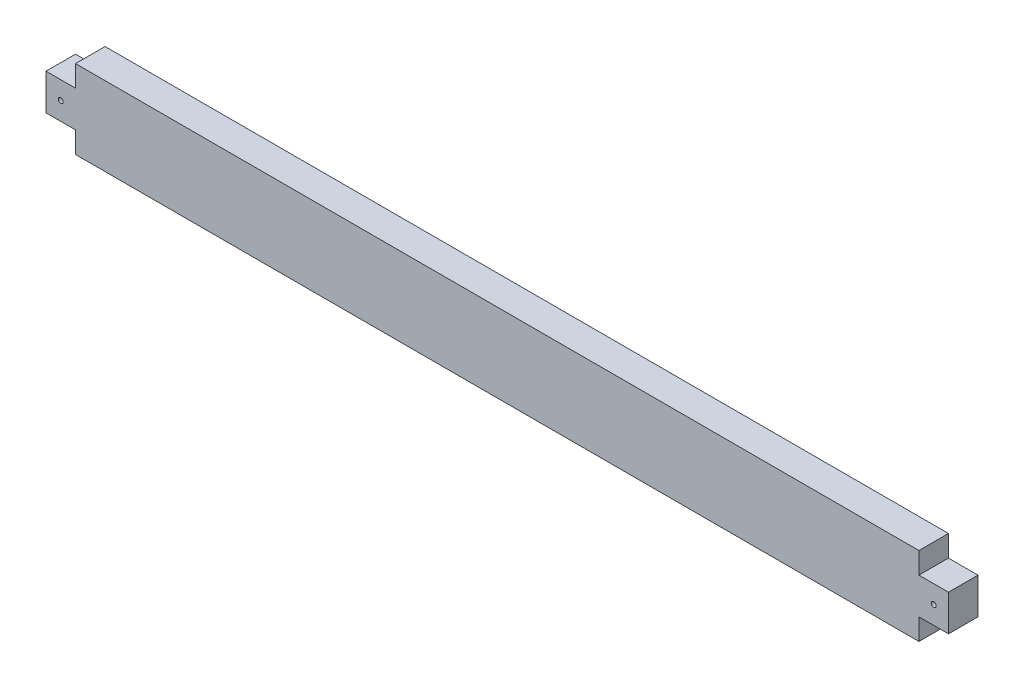
from build123d import *

# Parameters (mm, degrees)
SKETCH1_W             = 550
SKETCH1_H             = 48
EXTRUDE_359_DEPTH     = 18
CUT_EXTRUDE_620_REACH = 278.632
SKETCH2_W             = 18
SKETCH2_H             = 13
CUT_EXTRUDE_940_REACH = 278.632
SKETCH3_R             = 1.5


with BuildPart() as part:
    # Sketch1 → Extrude 359 (new body)
    with BuildSketch(Plane.XY):
        Rectangle(SKETCH1_W, SKETCH1_H)
    extrude(amount=EXTRUDE_359_DEPTH)

    # Sketch2 → Cut-Extrude 620 (cut, up to next)
    with BuildSketch(Plane.XY.offset(18), mode=Mode.PRIVATE) as cut_extrude_620_sk1:
        with Locations((-266, -17.5)):
            Rectangle(SKETCH2_W, SKETCH2_H)
    cut_extrude_620_tool1 = extrude(cut_extrude_620_sk1.sketch, amount=-CUT_EXTRUDE_620_REACH, mode=Mode.PRIVATE) & part.part
    # Sketch2 → Cut-Extrude 620 (cut, up to next)
    with BuildSketch(Plane.XY.offset(18), mode=Mode.PRIVATE) as cut_extrude_620_sk2:
        with Locations((-266, 17.5)):
            Rectangle(SKETCH2_W, SKETCH2_H)
    cut_extrude_620_tool2 = extrude(cut_extrude_620_sk2.sketch, amount=-CUT_EXTRUDE_620_REACH, mode=Mode.PRIVATE) & part.part
    cut_extrude_620_1 = cut_extrude_620_tool1.solids().sort_by_distance((-266, -17.5, 18))[0]
    add(cut_extrude_620_1, mode=Mode.SUBTRACT)
    cut_extrude_620_2 = cut_extrude_620_tool2.solids().sort_by_distance((-266, 17.5, 18))[0]
    add(cut_extrude_620_2, mode=Mode.SUBTRACT)
    cut_extrude_620 = cut_extrude_620_1 + cut_extrude_620_2  # Cut-Extrude 620 as one shape, for the pattern or mirror that repeats it

    # Sketch3 → Cut-Extrude 940 (cut, up to next)
    with BuildSketch(Plane.XY.offset(18), mode=Mode.PRIVATE) as cut_extrude_940_sk1:
        with Locations((-266, 0)):
            Circle(SKETCH3_R)
    cut_extrude_940_tool1 = extrude(cut_extrude_940_sk1.sketch, amount=-CUT_EXTRUDE_940_REACH, mode=Mode.PRIVATE) & part.part
    cut_extrude_940 = cut_extrude_940_tool1.solids().sort_by_distance((-266, 0, 18))[0]
    add(cut_extrude_940, mode=Mode.SUBTRACT)

    # Mirror1: Cut-Extrude 620, Cut-Extrude 940 across plane
    add(cut_extrude_620.mirror(Plane(origin=(0, 0, 0), x_dir=(0, 0, 1), z_dir=(1, 0, 0))), mode=Mode.SUBTRACT)
    add(cut_extrude_940.mirror(Plane(origin=(0, 0, 0), x_dir=(0, 0, 1), z_dir=(1, 0, 0))), mode=Mode.SUBTRACT)


solid = part.part
